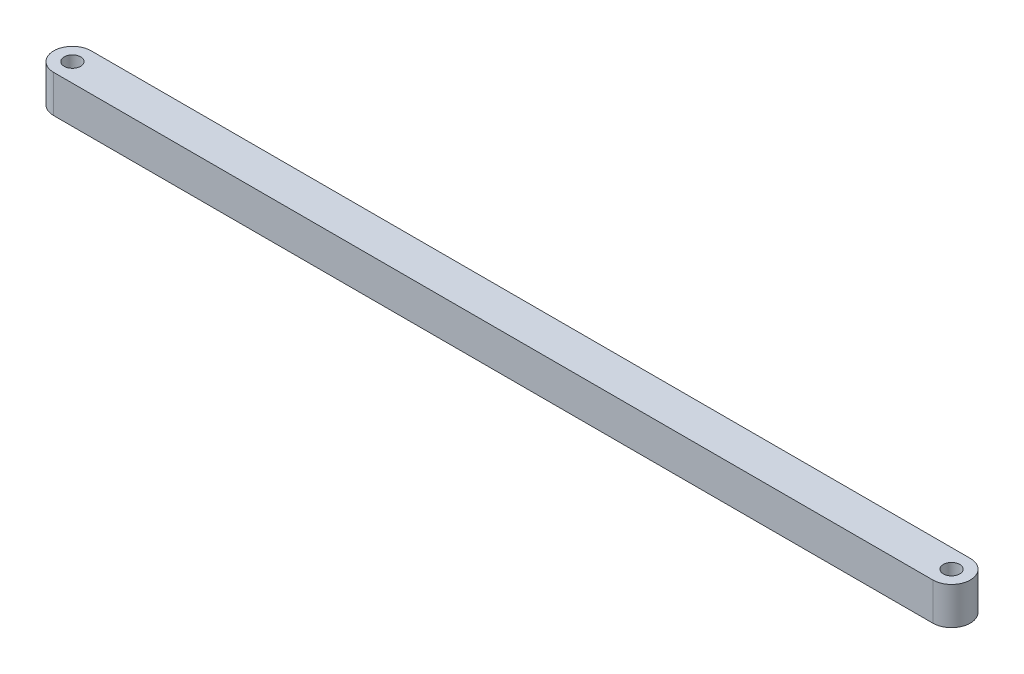
from build123d import *

# Parameters (mm, degrees)
SKETCH1_R           = 1.1
BOSS_EXTRUDE1_DEPTH = 5


with BuildPart() as part:
    # Sketch1 → Boss-Extrude1 (new body)
    with BuildSketch(Plane(origin=(0, 0, 0), x_dir=(1, 0, 0), z_dir=(0, 1, 0))):
        with BuildLine():
            Line((-58.7, 2.5), (58.7, 2.5))
            ThreePointArc((58.7, 2.5), (61.2, 0), (58.7, -2.5))
            Line((58.7, -2.5), (-58.7, -2.5))
            ThreePointArc((-58.7, -2.5), (-61.2, 0), (-58.7, 2.5))
        make_face()
        with Locations((-58.7, 0)):
            Circle(SKETCH1_R, mode=Mode.SUBTRACT)
        with Locations((58.7, 0)):
            Circle(SKETCH1_R, mode=Mode.SUBTRACT)
    extrude(amount=BOSS_EXTRUDE1_DEPTH)


solid = part.part
